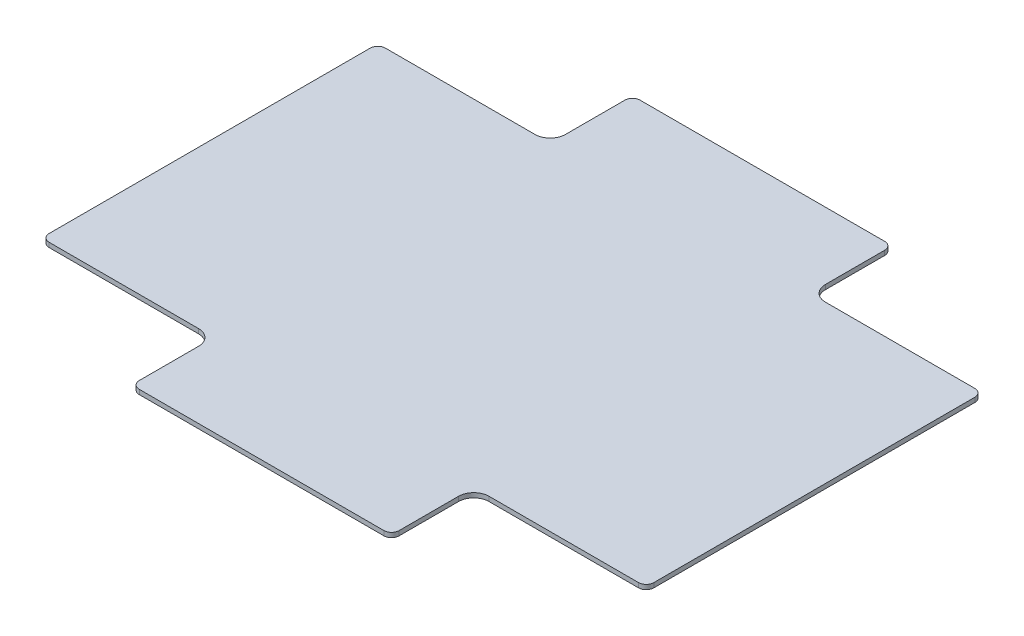
from build123d import *

# Parameters (mm, degrees)
EXTRUDE_1_DEPTH = 3


with BuildPart() as part:
    # Эскиз1 → Бобышка-Вытянуть1 (new body)
    with BuildSketch(Plane(origin=(0, 0, 0), x_dir=(1, 0, 0), z_dir=(0, 1, 0))):
        with BuildLine():
            ThreePointArc((-85, -158.805454142), (-83.535533906, -162.340988048), (-80, -163.805454142))
            Line((-80, -163.805454142), (80, -163.805454142))
            ThreePointArc((80, -163.805454142), (83.535533906, -162.340988048), (85, -158.805454142))
            Line((85, -158.805454142), (85, -120))
            ThreePointArc((85, -120), (87.928932188, -112.928932188), (95, -110))
            Line((95, -110), (192.768667216, -110))
            ThreePointArc((192.768667216, -110), (196.304201122, -108.535533906), (197.768667216, -105))
            Line((197.768667216, -105), (197.768667216, 105))
            ThreePointArc((197.768667216, 105), (196.304201122, 108.535533906), (192.768667216, 110))
            Line((192.768667216, 110), (95, 110))
            ThreePointArc((95, 110), (87.928932188, 112.928932188), (85, 120))
            Line((85, 120), (85, 158.805454142))
            ThreePointArc((85, 158.805454142), (83.535533906, 162.340988048), (80, 163.805454142))
            Line((80, 163.805454142), (-80, 163.805454142))
            ThreePointArc((-80, 163.805454142), (-83.535533906, 162.340988048), (-85, 158.805454142))
            Line((-85, 158.805454142), (-85, 120))
            ThreePointArc((-85, 120), (-87.928932188, 112.928932188), (-95, 110))
            Line((-95, 110), (-192.768667216, 110))
            ThreePointArc((-192.768667216, 110), (-196.304201122, 108.535533906), (-197.768667216, 105))
            Line((-197.768667216, 105), (-197.768667216, -105))
            ThreePointArc((-197.768667216, -105), (-196.304201122, -108.535533906), (-192.768667216, -110))
            Line((-192.768667216, -110), (-95, -110))
            ThreePointArc((-95, -110), (-87.928932188, -112.928932188), (-85, -120))
            Line((-85, -120), (-85, -158.805454142))
        make_face()
    extrude(amount=EXTRUDE_1_DEPTH)


solid = part.part
